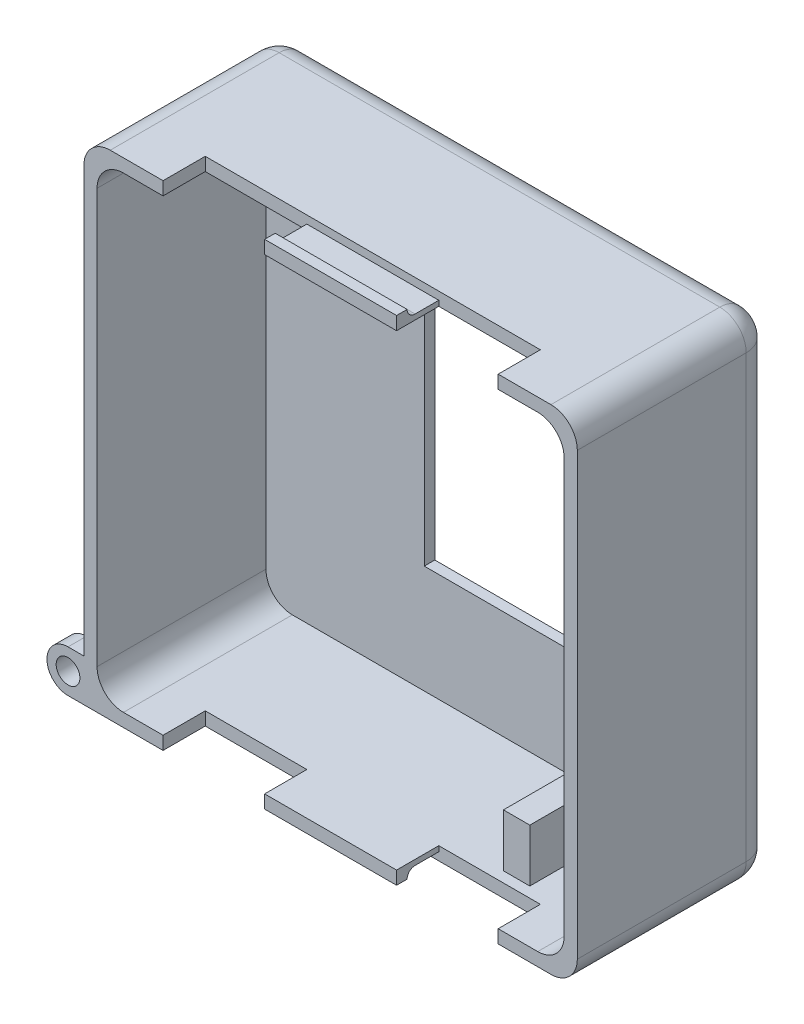
from build123d import *

# Parameters (mm, degrees)
BOSS_EXTRUDE1_DEPTH             = 18.796
CUT_EXTRUDE1_DEPTH              = 16.256
FILLET1_R                       = 2.54
CUT_EXTRUDE2_DEPTH              = 57.332624837
CUT_EXTRUDE2_DEPTH_BACK         = 57.332624837
SKETCH3_W                       = 32.258
SKETCH3_H                       = 8.128
SKETCH5_W                       = 26.924
SKETCH5_H                       = 34.29
CUT_EXTRUDE4_DEPTH              = 1.524
SKETCH6_W                       = 16.764
SKETCH6_H                       = 24.13
CUT_EXTRUDE5_DEPTH              = 1.524
SKETCH8_W                       = 12.7
SKETCH8_H                       = 0.508
BOSS_EXTRUDE3_DEPTH             = 4.064
SKETCH9_W                       = 12.7
SKETCH9_H                       = 1.016
BOSS_EXTRUDE4_DEPTH             = 0.762
FILLET2_R                       = 0.762
SKETCH10_W                      = 12.7
SKETCH10_H                      = 1.016
BOSS_EXTRUDE5_DEPTH             = 0.762
FILLET3_R                       = 0.762
SKETCH11_W                      = 1.778
SKETCH11_H                      = 4.064
BOSS_EXTRUDE6_DEPTH             = 3.556
BOSS_EXTRUDE6_DIRECTION_2_REACH = 58.333
FILLET4_RADIUS                  = 2.032
FILLET4_LENGTH                  = 1.778
SKETCH12_R                      = 1.143
CUT_EXTRUDE7_DEPTH              = 4.064
CUT_EXTRUDE8_DEPTH              = 0.762
SKETCH13_W                      = 2.54
SKETCH13_H                      = 5.08
BOSS_EXTRUDE7_DEPTH             = 16.256
SKETCH15_W                      = 11.176
SKETCH15_H                      = 2.54
BOSS_EXTRUDE8_DEPTH             = 3.556


with BuildPart() as part:
    # Sketch1 → Boss-Extrude1 (new body)
    with BuildSketch(Plane.XY):
        with BuildLine():
            Line((-21.209, -23.749), (21.209, -23.749))
            ThreePointArc((21.209, -23.749), (23.005051224, -23.005051224), (23.749, -21.209))
            Line((23.749, -21.209), (23.749, 21.209))
            ThreePointArc((23.749, 21.209), (23.005051224, 23.005051224), (21.209, 23.749))
            Line((21.209, 23.749), (-21.209, 23.749))
            ThreePointArc((-21.209, 23.749), (-23.005051224, 23.005051224), (-23.749, 21.209))
            Line((-23.749, 21.209), (-23.749, -21.209))
            ThreePointArc((-23.749, -21.209), (-23.005051224, -23.005051224), (-21.209, -23.749))
        make_face()
    extrude(amount=BOSS_EXTRUDE1_DEPTH)

    # Sketch2 → Cut-Extrude1 (cut)
    with BuildSketch(Plane.XY.offset(18.796)):
        with BuildLine():
            Line((19.939, -22.479), (-19.939, -22.479))
            ThreePointArc((-19.939, -22.479), (-21.735051224, -21.735051224), (-22.479, -19.939))
            Line((-22.479, -19.939), (-22.479, 19.939))
            ThreePointArc((-22.479, 19.939), (-21.735051224, 21.735051224), (-19.939, 22.479))
            Line((-19.939, 22.479), (19.939, 22.479))
            ThreePointArc((19.939, 22.479), (21.735051224, 21.735051224), (22.479, 19.939))
            Line((22.479, 19.939), (22.479, -19.939))
            ThreePointArc((22.479, -19.939), (21.735051224, -21.735051224), (19.939, -22.479))
        make_face()
    extrude(amount=-CUT_EXTRUDE1_DEPTH, mode=Mode.SUBTRACT)

    # Fillet1
    fillet1_edges = [part.edges().sort_by_distance(p)[0] for p in [
        (0, -23.749, 0),
        (-23.005051224, -23.005051224, 0),
        (-23.749, 0, 0),
        (-23.005051224, 23.005051224, 0),
        (0, 23.749, 0),
        (23.005051224, 23.005051224, 0),
        (23.749, 0, 0),
        (23.005051224, -23.005051224, 0),
    ]]
    fillet(fillet1_edges, radius=FILLET1_R)

    # Sketch3 → Cut-Extrude2 (cut, two sides: drawn at the far end of the back side and taken through both)
    with BuildSketch(Plane(origin=(0, 23.749, 0), x_dir=(1, 0, 0), z_dir=(0, 1, 0)).offset(-CUT_EXTRUDE2_DEPTH_BACK)):
        with Locations((0, -18.796)):
            Rectangle(SKETCH3_W, SKETCH3_H)
    extrude(amount=CUT_EXTRUDE2_DEPTH + CUT_EXTRUDE2_DEPTH_BACK, mode=Mode.SUBTRACT)

    # Sketch5 → Cut-Extrude4 (cut)
    with BuildSketch(Plane(origin=(0, 0, 0), x_dir=(-1, 0, 0), z_dir=(0, 0, -1))):
        with Locations((-1.143, 0)):
            Rectangle(SKETCH5_W, SKETCH5_H)
    extrude(amount=-CUT_EXTRUDE4_DEPTH, mode=Mode.SUBTRACT)

    # Sketch6 → Cut-Extrude5 (cut)
    with BuildSketch(Plane(origin=(0, 0, 1.524), x_dir=(-1, 0, 0), z_dir=(0, 0, -1))):
        with Locations((-1.143, 0)):
            Rectangle(SKETCH6_W, SKETCH6_H)
    extrude(amount=-CUT_EXTRUDE5_DEPTH, mode=Mode.SUBTRACT)

    # Sketch8 → Boss-Extrude3 (add)
    with BuildSketch(Plane.XY.offset(14.732)):
        with Locations((0, 22.733)):
            Rectangle(SKETCH8_W, SKETCH8_H)
        with Locations((0, -22.733)):
            Rectangle(SKETCH8_W, SKETCH8_H)
    extrude(amount=BOSS_EXTRUDE3_DEPTH)

    # Sketch9 → Boss-Extrude4 (add)
    with BuildSketch(Plane(origin=(0, 22.987, 0), x_dir=(1, 0, 0), z_dir=(0, 1, 0))):
        with Locations((0, -18.288)):
            Rectangle(SKETCH9_W, SKETCH9_H)
    extrude(amount=BOSS_EXTRUDE4_DEPTH)

    # Fillet2
    fillet2_edges = [part.edges().sort_by_distance(p)[0] for p in [
        (0, 22.987, 17.78),
    ]]
    fillet(fillet2_edges, radius=FILLET2_R - 0.0001)  # a hair under: the kernel refuses the full size

    # Sketch10 → Boss-Extrude5 (add)
    with BuildSketch(Plane.XZ.offset(22.987)):
        with Locations((0, 18.288)):
            Rectangle(SKETCH10_W, SKETCH10_H)
    extrude(amount=BOSS_EXTRUDE5_DEPTH)

    # Fillet3
    fillet3_edges = [part.edges().sort_by_distance(p)[0] for p in [
        (0, -22.987, 17.78),
    ]]
    fillet(fillet3_edges, radius=FILLET3_R - 0.0001)  # a hair under: the kernel refuses the full size

    # Sketch11 → Boss-Extrude6 (add)
    with BuildSketch(Plane.ZY.offset(23.749)):
        with Locations((17.907, -21.717)):
            Rectangle(SKETCH11_W, SKETCH11_H)
    extrude(amount=BOSS_EXTRUDE6_DEPTH)

    # Sketch11 → Boss-Extrude6 direction 2 (add, up to next)
    with BuildSketch(Plane.ZY.offset(23.749), mode=Mode.PRIVATE) as boss_extrude6_direction_2_sk1:
        with Locations((17.907, -21.717)):
            Rectangle(SKETCH11_W, SKETCH11_H)
    boss_extrude6_direction_2_tool1 = extrude(boss_extrude6_direction_2_sk1.sketch, amount=-BOSS_EXTRUDE6_DIRECTION_2_REACH, mode=Mode.PRIVATE) - part.part
    add(boss_extrude6_direction_2_tool1.solids().sort_by_distance((-23.749, -21.717, 17.907))[0])

    # Fillet4: full round fillet: the end face becomes a half cylinder, R = half its width
    fillet4_face = Plane((-27.305, -21.717, 17.907), x_dir=(0, 0, -1), z_dir=(-1, 0, 0))  # on the end face: x along it, z out of the body
    fillet4_slab = fillet4_face.offset(-FILLET4_RADIUS / 2) * Box(FILLET4_LENGTH, 2 * FILLET4_RADIUS, FILLET4_RADIUS, mode=Mode.PRIVATE)  # the body's end, R deep
    fillet4_round = Plane((-25.273, -21.717, 17.907), x_dir=(-1, 0, 0), z_dir=(0, 0, -1)) * Cylinder(FILLET4_RADIUS, FILLET4_LENGTH, mode=Mode.PRIVATE)  # its axis R under the face
    add(fillet4_slab - fillet4_round, mode=Mode.SUBTRACT)

    # Sketch12 → Cut-Extrude7 (cut)
    with BuildSketch(Plane(origin=(0, 0, 17.018), x_dir=(-1, 0, 0), z_dir=(0, 0, -1))):
        with Locations((25.273, -21.717)):
            Circle(SKETCH12_R)
    extrude(amount=-CUT_EXTRUDE7_DEPTH, mode=Mode.SUBTRACT)

    # Sketch7 → Cut-Extrude8 (cut)
    with BuildSketch(Plane(origin=(0, 0, 0), x_dir=(-1, 0, 0), z_dir=(0, 0, -1))):
        with BuildLine():
            Line((19.939, 17.145), (21.209, 17.145))
            ThreePointArc((21.209, 17.145), (17.399, 20.955), (13.589, 17.145))
            Line((13.589, 17.145), (14.859, 17.145))
            ThreePointArc((14.859, 17.145), (17.399, 19.685), (19.939, 17.145))
        make_face()
        with BuildLine():
            Line((21.209, 15.875), (16.129, 15.875))
            ThreePointArc((16.129, 15.875), (13.589, 13.335), (16.129, 10.795))
            Line((16.129, 10.795), (21.209, 10.795))
            Line((21.209, 10.795), (21.209, 12.065))
            Line((21.209, 12.065), (16.129, 12.065))
            ThreePointArc((16.129, 12.065), (14.859, 13.335), (16.129, 14.605))
            Line((16.129, 14.605), (21.209, 14.605))
            Line((21.209, 14.605), (21.209, 15.875))
        make_face()
        Polygon((13.589, 9.525), (21.209, 9.525), (21.209, 5.715), (19.939, 5.715), (19.939, 8.255), (18.034, 8.255), (18.034, 6.985), (16.764, 6.985), (16.764, 8.255), (13.589, 8.255), align=None)
        Polygon((13.589, 4.445), (21.209, 4.445), (21.209, 0.635), (19.939, 0.635), (19.939, 3.175), (18.034, 3.175), (18.034, 1.905), (16.764, 1.905), (16.764, 3.175), (13.589, 3.175), align=None)
        Polygon((21.209, -0.635), (13.589, -0.635), (13.589, -4.445), (14.859, -4.445), (14.859, -1.905), (21.209, -1.905), align=None)
        Polygon((13.589, -5.715), (21.209, -5.715), (21.209, -9.525), (19.939, -9.525), (19.939, -6.985), (18.034, -6.985), (18.034, -8.255), (16.764, -8.255), (16.764, -6.985), (14.859, -6.985), (14.859, -9.525), (13.589, -9.525), align=None)
        with BuildLine():
            Line((18.9865, -13.97), (18.9865, -15.24))
            ThreePointArc((18.9865, -15.24), (20.558044821, -11.445955179), (16.764, -13.0175))
            ThreePointArc((16.764, -13.0175), (15.137980791, -13.691019209), (15.8115, -12.065))
            Line((15.8115, -12.065), (15.8115, -10.795))
            ThreePointArc((15.8115, -10.795), (14.239955179, -14.589044821), (18.034, -13.0175))
            ThreePointArc((18.034, -13.0175), (19.660019209, -12.343980791), (18.9865, -13.97))
        make_face()
        with BuildLine():
            Line((15.8115, -17.78), (15.8115, -16.51))
            ThreePointArc((15.8115, -16.51), (14.239955179, -20.304044821), (18.034, -18.7325))
            ThreePointArc((18.034, -18.7325), (19.660019209, -18.058980791), (18.9865, -19.685))
            Line((18.9865, -19.685), (18.9865, -20.955))
            ThreePointArc((18.9865, -20.955), (20.558044821, -17.160955179), (16.764, -18.7325))
            ThreePointArc((16.764, -18.7325), (15.137980791, -19.406019209), (15.8115, -17.78))
        make_face()
    extrude(amount=-CUT_EXTRUDE8_DEPTH, mode=Mode.SUBTRACT)

    # Sketch13 → Boss-Extrude7 (add)
    with BuildSketch(Plane.XY.offset(2.54)):
        with Locations((17.907, -14.859)):
            Rectangle(SKETCH13_W, SKETCH13_H)
    extrude(amount=BOSS_EXTRUDE7_DEPTH)

    # Sketch15 → Boss-Extrude8 (add)
    with BuildSketch(Plane(origin=(19.177, 0, 0), x_dir=(0, 0, -1), z_dir=(1, 0, 0))):
        with Locations((-8.128, -14.859)):
            Rectangle(SKETCH15_W, SKETCH15_H)
    extrude(amount=BOSS_EXTRUDE8_DEPTH)


solid = part.part
